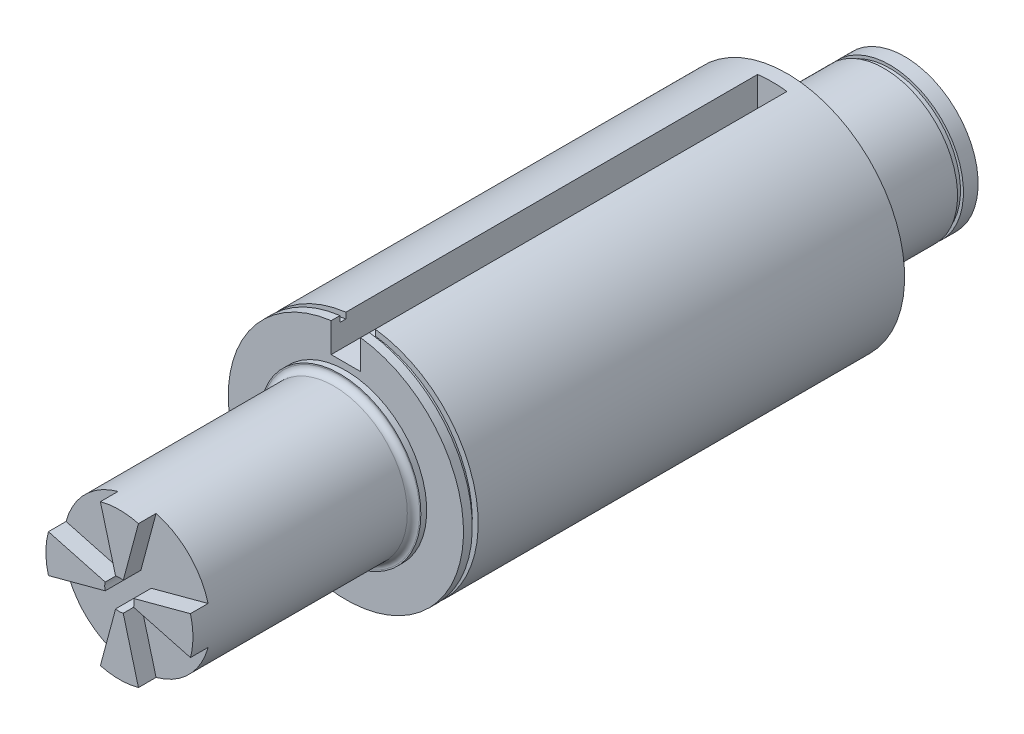
from build123d import *

# Parameters (mm, degrees)
ESQUISSE1_R                  = 25
BOSS_EXTRU_1_DEPTH           = 100
BOSS_EXTRU_3_DEPTH           = 150
ESQUISSE5_R                  = 25
BOSS_EXTRU_4_DEPTH           = 40
ESQUISSE6_R                  = 27.5
BOSS_EXTRU_5_DEPTH           = 2
CONG_2_R                     = 2.1
CONG_3_R                     = 2.1
ESQUISSE7_R                  = 25
ESQUISSE7_R_2                = 24
ENL_V_MAT_EXTRU_1_DEPTH      = 2
BOSS_EXTRU_6_START           = -5
BOSS_EXTRU_6_DEPTH           = 5
ENL_V_START                  = 2
ESQUISSE10_R                 = 40
ESQUISSE10_R_2               = 38
ENL_V_MAT_EXTRU_2_DEPTH      = 2
ENL_V_MAT_EXTRU_4_DEPTH      = 23
R_P_TITION_CIRCULAIRE2_COUNT = 4
ENL_V_MAT_EXTRU_5_DEPTH      = 29


with BuildPart() as part:
    # Esquisse1 → Boss.-Extru.1 (new body)
    with BuildSketch(Plane.XY):
        Circle(ESQUISSE1_R)
    extrude(amount=-BOSS_EXTRU_1_DEPTH)

    # Esquisse4 → Boss.-Extru.3 (add)
    with BuildSketch(Plane(origin=(0, 0, -100), x_dir=(-1, 0, 0), z_dir=(0, 0, -1))):
        with BuildLine():
            Line((-5, 39.686269666), (-5, 29.686269666))
            Line((-5, 29.686269666), (5, 29.686269666))
            Line((5, 29.686269666), (5, 39.686269666))
            ThreePointArc((5, 39.686269666), (0, -40), (-5, 39.686269666))
        make_face()
    extrude(amount=BOSS_EXTRU_3_DEPTH)

    # Esquisse5 → Boss.-Extru.4 (add)
    with BuildSketch(Plane(origin=(0, 0, -250), x_dir=(-1, 0, 0), z_dir=(0, 0, -1))):
        Circle(ESQUISSE5_R)
    extrude(amount=BOSS_EXTRU_4_DEPTH)

    # Esquisse6 → Boss.-Extru.5 (add)
    with BuildSketch(Plane.XY.offset(-100)):
        Circle(ESQUISSE6_R)
    boss_extru_5 = extrude(amount=BOSS_EXTRU_5_DEPTH)

    # Congé2
    cong_2_edges = [part.edges().sort_by_distance(p)[0] for p in [
        (-25, 0, -98),
    ]]
    fillet(cong_2_edges, radius=CONG_2_R)

    # Symétrie3: Boss.-Extru.5 across plane
    add(boss_extru_5.mirror(Plane.XY.offset(-175)))

    # Congé3
    cong_3_edges = [part.edges().sort_by_distance(p)[0] for p in [
        (25, 0, -252),
    ]]
    fillet(cong_3_edges, radius=CONG_3_R)

    # Esquisse7 → Enlèv. mat.-Extru.1 (cut)
    with BuildSketch(Plane(origin=(0, 0, -283), x_dir=(-1, 0, 0), z_dir=(0, 0, -1))):
        Circle(ESQUISSE7_R)
        Circle(ESQUISSE7_R_2, mode=Mode.SUBTRACT)
    extrude(amount=ENL_V_MAT_EXTRU_1_DEPTH, mode=Mode.SUBTRACT)

    # Esquisse9 → Boss.-Extru.6 (add)
    with BuildSketch(Plane(origin=(0, 0, -250), x_dir=(-1, 0, 0), z_dir=(0, 0, -1)).offset(BOSS_EXTRU_6_START)):
        with BuildLine():
            ThreePointArc((5, 39.686269666), (0, 40), (-5, 39.686269666))
            Line((-5, 39.686269666), (-5, 29.686269666))
            Line((-5, 29.686269666), (5, 29.686269666))
            Line((5, 29.686269666), (5, 39.686269666))
        make_face()
    extrude(amount=BOSS_EXTRU_6_DEPTH)

    # Esquisse10 → Enlèv. mat.-Extru.2 (cut)
    with BuildSketch(Plane.XY.offset(-105).offset(ENL_V_START)):
        Circle(ESQUISSE10_R)
        Circle(ESQUISSE10_R_2, mode=Mode.SUBTRACT)
    extrude(amount=-ENL_V_MAT_EXTRU_2_DEPTH, mode=Mode.SUBTRACT)

    # Esquisse14 → Enlèv. mat.-Extru.4 (cut)
    with BuildSketch(Plane.XY):
        with BuildLine():
            Line((-6.470476128, 24.148145657), (-1.294095226, 4.829629131))
            ThreePointArc((-1.294095226, 4.829629131), (0, 5), (1.294095226, 4.829629131))
            Line((1.294095226, 4.829629131), (6.470476128, 24.148145657))
            ThreePointArc((6.470476128, 24.148145657), (0, 25), (-6.470476128, 24.148145657))
        make_face()
    enl_v_mat_extru_4 = extrude(amount=-ENL_V_MAT_EXTRU_4_DEPTH, mode=Mode.SUBTRACT)

    # Répétition circulaire2: Enlèv. mat.-Extru.4 ×4 about axis
    r_p_tition_circulaire2_axis = Axis((0, 0, 0), (0, 0, -1))
    for i in range(1, R_P_TITION_CIRCULAIRE2_COUNT):
        add(enl_v_mat_extru_4.rotate(r_p_tition_circulaire2_axis, i * 360 / R_P_TITION_CIRCULAIRE2_COUNT), mode=Mode.SUBTRACT)

    # Esquisse15 → Enlèv. mat.-Extru.5 (cut)
    with BuildSketch(Plane.XY):
        with BuildLine():
            Line((6.470476128, 24.148145657), (1.294095226, 4.829629131))
            ThreePointArc((1.294095226, 4.829629131), (0, 5), (-1.294095226, 4.829629131))
            Line((-1.294095226, 4.829629131), (-6.470476128, 24.148145657))
            ThreePointArc((-6.470476128, 24.148145657), (-17.67766953, 17.67766953), (-24.148145657, 6.470476128))
            Line((-24.148145657, 6.470476128), (-4.829629131, 1.294095226))
            ThreePointArc((-4.829629131, 1.294095226), (-5, 0), (-4.829629131, -1.294095226))
            Line((-4.829629131, -1.294095226), (-24.148145657, -6.470476128))
            ThreePointArc((-24.148145657, -6.470476128), (-17.67766953, -17.67766953), (-6.470476128, -24.148145657))
            Line((-6.470476128, -24.148145657), (-1.294095226, -4.829629131))
            ThreePointArc((-1.294095226, -4.829629131), (0, -5), (1.294095226, -4.829629131))
            Line((1.294095226, -4.829629131), (6.470476128, -24.148145657))
            ThreePointArc((6.470476128, -24.148145657), (17.67766953, -17.67766953), (24.148145657, -6.470476128))
            Line((24.148145657, -6.470476128), (4.829629131, -1.294095226))
            ThreePointArc((4.829629131, -1.294095226), (5, 0), (4.829629131, 1.294095226))
            Line((4.829629131, 1.294095226), (24.148145657, 6.470476128))
            ThreePointArc((24.148145657, 6.470476128), (17.67766953, 17.67766953), (6.470476128, 24.148145657))
        make_face()
    extrude(amount=-ENL_V_MAT_EXTRU_5_DEPTH, mode=Mode.SUBTRACT)


solid = part.part
